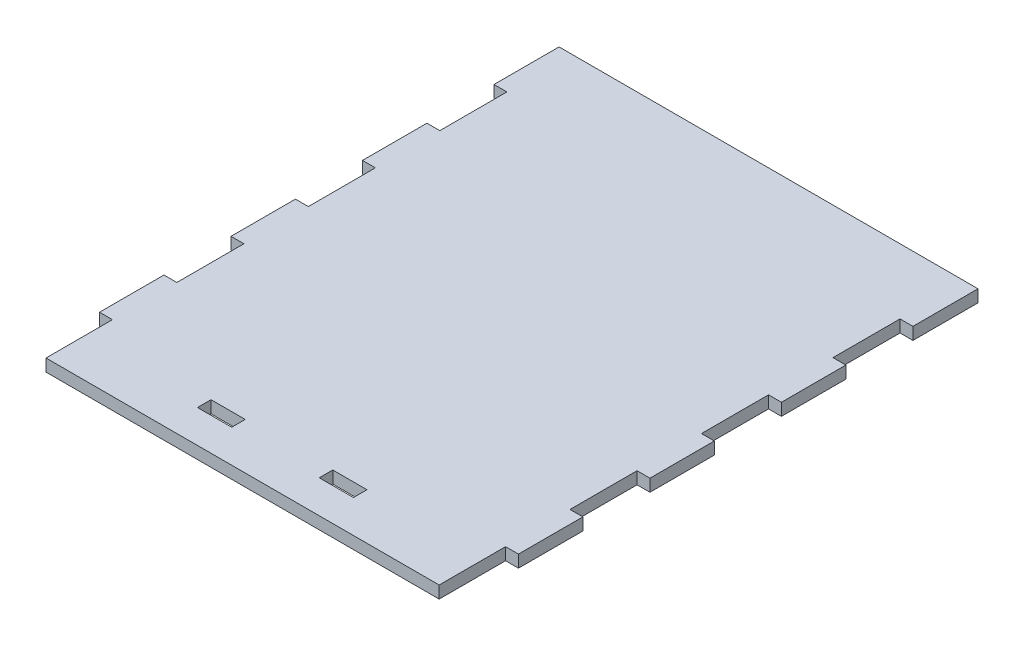
from build123d import *

# Parameters (mm, degrees)
BOSS_EXTRUDE1_DEPTH = 2.3622
CUT_EXTRUDE1_DEPTH  = 129.530658543
SKETCH3_W           = 6.604
SKETCH3_H           = 2.6162
CUT_EXTRUDE2_DEPTH  = 129.452945695


with BuildPart() as part:
    # Sketch1 → Boss-Extrude1 (new body)
    with BuildSketch(Plane(origin=(0, 0, 0), x_dir=(1, 0, 0), z_dir=(0, 1, 0))):
        Polygon((0, 0), (76.2, 0), (76.2, 12.7), (78.6892, 12.7), (78.6892, 25.4), (76.2, 25.4), (76.2, 38.1), (78.6892, 38.1), (78.6892, 50.8), (76.2, 50.8), (76.2, 63.5), (78.6892, 63.5), (78.6892, 76.2), (76.2, 76.2), (76.2, 88.9), (78.6892, 88.9), (78.6892, 101.6), (-2.4892, 101.6), (-2.4892, 88.9), (0, 88.9), (0, 76.2), (-2.4892, 76.2), (-2.4892, 63.5), (0, 63.5), (0, 50.8), (-2.4892, 50.8), (-2.4892, 38.1), (0, 38.1), (0, 25.4), (-2.4892, 25.4), (-2.4892, 12.7), (0, 12.7), align=None)
    extrude(amount=BOSS_EXTRUDE1_DEPTH)

    # Sketch2 → Cut-Extrude1 (cut, through all)
    with BuildSketch(Plane(origin=(0, 2.3622, 0), x_dir=(1, 0, 0), z_dir=(0, 1, 0))):
        Polygon((-2.3622, 101.6), (-2.4892, 101.6), (-2.4892, 88.9), (0, 88.9), (0, 76.2), (-2.4892, 76.2), (-2.4892, 63.5), (0, 63.5), (0, 50.8), (-2.4892, 50.8), (-2.4892, 38.1), (0, 38.1), (0, 25.4), (-2.4892, 25.4), (-2.4892, 12.7), (0, 12.7), (0, 0), (0.127, 0), (0.127, 12.827), (-2.3622, 12.827), (-2.3622, 25.273), (0.127, 25.273), (0.127, 38.227), (-2.3622, 38.227), (-2.3622, 50.673), (0.127, 50.673), (0.127, 63.627), (-2.3622, 63.627), (-2.3622, 76.073), (0.127, 76.073), (0.127, 89.027), (-2.3622, 89.027), align=None)
        Polygon((78.6892, 101.6), (78.5622, 101.6), (78.5622, 89.027), (76.073, 89.027), (76.073, 76.073), (78.5622, 76.073), (78.5622, 63.627), (76.073, 63.627), (76.073, 50.673), (78.5622, 50.673), (78.5622, 38.227), (76.073, 38.227), (76.073, 25.273), (78.5622, 25.273), (78.5622, 12.827), (76.073, 12.827), (76.073, 0), (76.2, 0), (76.2, 12.7), (78.6892, 12.7), (78.6892, 25.4), (76.2, 25.4), (76.2, 38.1), (78.6892, 38.1), (78.6892, 50.8), (76.2, 50.8), (76.2, 63.5), (78.6892, 63.5), (78.6892, 76.2), (76.2, 76.2), (76.2, 88.9), (78.6892, 88.9), align=None)
    extrude(amount=-CUT_EXTRUDE1_DEPTH, mode=Mode.SUBTRACT)

    # Sketch3 → Cut-Extrude2 (cut, through all)
    with BuildSketch(Plane.XZ):
        with Locations((26.3398, -7.6581)):
            Rectangle(SKETCH3_W, SKETCH3_H)
        with Locations((49.8602, -7.6581)):
            Rectangle(SKETCH3_W, SKETCH3_H)
    extrude(amount=-CUT_EXTRUDE2_DEPTH, mode=Mode.SUBTRACT)


solid = part.part
